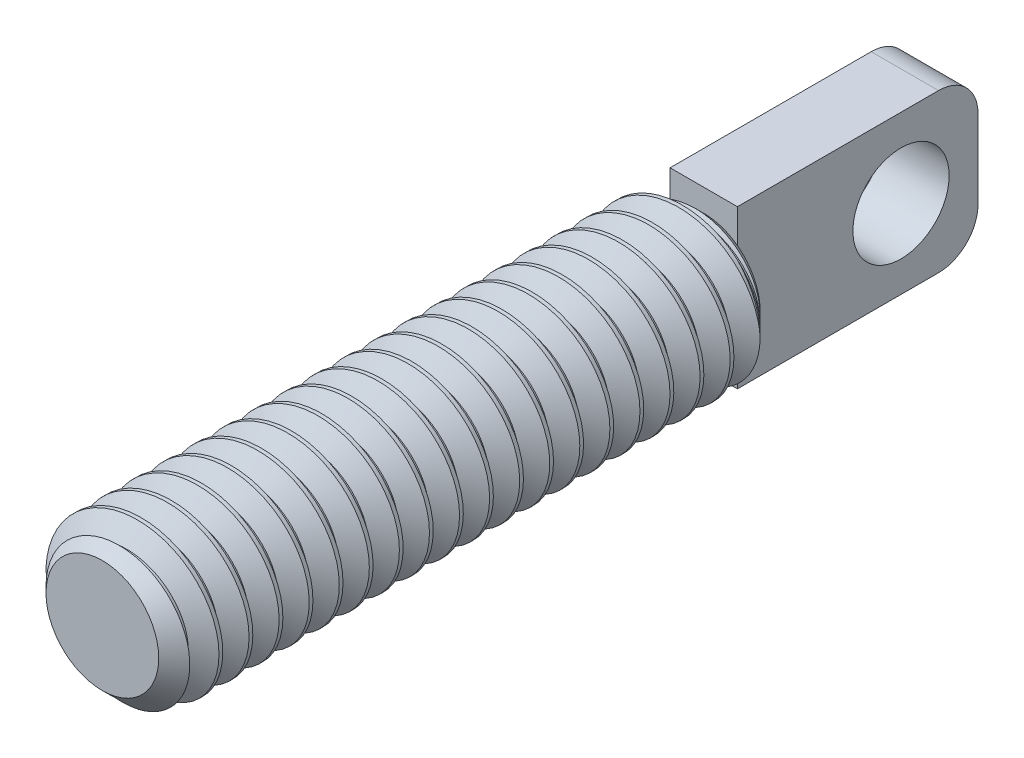
from build123d import *

# Parameters (mm, degrees)
SKETCH1_R           = 2.0828
BOSS_EXTRUDE1_DEPTH = 7.9375
CHAMFER1_SIZE       = 0.5953125
CUT_SWEEP1_PITCH    = 0.79375
SKETCH4_R           = 1.27
BOSS_EXTRUDE2_DEPTH = 0.889


with BuildPart() as part:
    # Sketch1 → Boss-Extrude1 (new, symmetric)
    with BuildSketch(Plane.XY):
        Circle(SKETCH1_R)
    extrude(amount=BOSS_EXTRUDE1_DEPTH, both=True)

    # Chamfer1
    chamfer1_edges = [part.edges().sort_by_distance(p)[0] for p in [
        (-2.0828, 0, -7.9375),
        (-2.0828, 0, 7.9375),
    ]]
    chamfer(chamfer1_edges, length=CHAMFER1_SIZE)

    # Cut-Sweep1: the profile of Sketch3 profile screwed along a right-hand helix of 21 turns, 8 arcs to a turn; built about Z, then put on its axis
    cut_sweep1_z = Axis((0, 0, 0), (0, 0, 1))
    cut_sweep1_corners = [(2.0831, 0, 0.000173205), (1.567244252, 0, -0.29765625), (1.567244252, 0, -0.396875), (2.0831, 0, -0.694704455)]
    with BuildLine(mode=Mode.PRIVATE) as cut_sweep1_profile:
        Line(cut_sweep1_corners[0], cut_sweep1_corners[1])
        Line(cut_sweep1_corners[1], cut_sweep1_corners[2])
        Line(cut_sweep1_corners[2], cut_sweep1_corners[3])
        Line(cut_sweep1_corners[3], cut_sweep1_corners[0])
    cut_sweep1_cap = Face(cut_sweep1_profile.wire())
    cut_sweep1_turn_angles = [0, 22.5, 45, 67.5, 90, 112.5, 135, 157.5, 180, 202.5, 225, 247.5, 270, 292.5, 315, 337.5, 360]
    cut_sweep1_turn_weights = [1, 0.9238795325112867, 1, 0.9238795325112867, 1, 0.9238795325112867, 1, 0.9238795325112867, 1, 0.9238795325112867, 1, 0.9238795325112867, 1, 0.9238795325112867, 1, 0.9238795325112867, 1]
    cut_sweep1_turn_rails = [Edge.make_bspline([Vector(p[0], p[1], 0).rotate(cut_sweep1_z, cut_sweep1_turn_angles[k]) / cut_sweep1_turn_weights[k] + Vector(0, 0, p[2] + CUT_SWEEP1_PITCH * cut_sweep1_turn_angles[k] / 360) for k in range(17)], [0, 0, 0, 1, 1, 2, 2, 3, 3, 4, 4, 5, 5, 6, 6, 7, 7, 8, 8, 8], 2, cut_sweep1_turn_weights) for p in cut_sweep1_corners]
    cut_sweep1_turn_sides = [Face.make_surface_from_curves(cut_sweep1_turn_rails[p[0]], cut_sweep1_turn_rails[p[1]]) for p in [(0, 1), (1, 2), (2, 3), (3, 0)]]
    cut_sweep1 = Plane(origin=(0, 0, 7.9375), x_dir=(0, 1, 0), z_dir=(0, 0, -1)) * Solid(Shell([*[p.moved(Location((0, 0, CUT_SWEEP1_PITCH * i))) for i in range(21) for p in cut_sweep1_turn_sides], cut_sweep1_cap, cut_sweep1_cap.rotate(cut_sweep1_z, 7560).moved(Location((0, 0, CUT_SWEEP1_PITCH * 7560 / 360)))]))
    add(cut_sweep1, mode=Mode.SUBTRACT)

    # Sketch4 → Boss-Extrude2 (add, symmetric)
    with BuildSketch(Plane(origin=(0, 0, 0), x_dir=(0, 0, -1), z_dir=(1, 0, 0))):
        with BuildLine():
            Line((14.2875, 1.0414), (14.2875, -1.0414))
            ThreePointArc((14.2875, -1.0414), (13.982481002, -1.777781002), (13.2461, -2.0828))
            Line((13.2461, -2.0828), (7.9375, -2.0828))
            Line((7.9375, -2.0828), (7.9375, 2.0828))
            Line((7.9375, 2.0828), (13.2461, 2.0828))
            ThreePointArc((13.2461, 2.0828), (13.982481002, 1.777781002), (14.2875, 1.0414))
        make_face()
        with Locations((12.2555, 0)):
            Circle(SKETCH4_R, mode=Mode.SUBTRACT)
    extrude(amount=BOSS_EXTRUDE2_DEPTH, both=True)


solid = part.part
